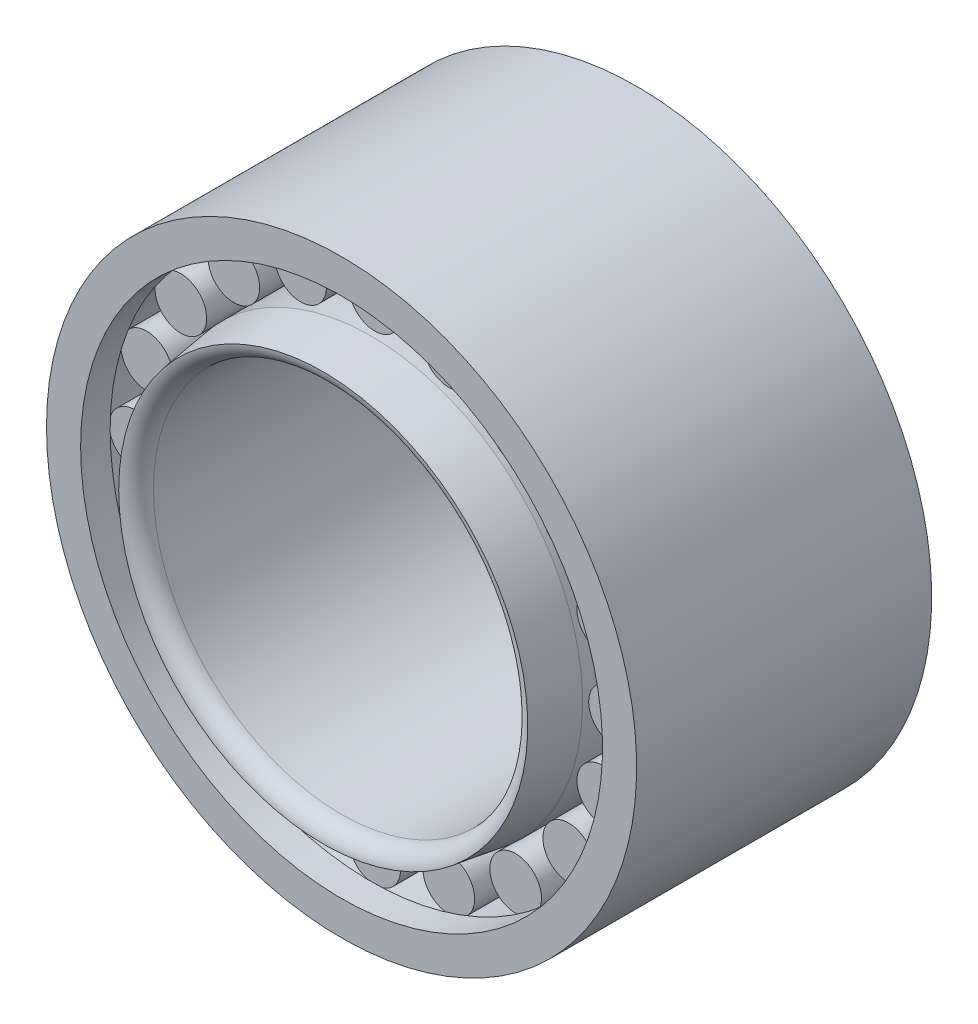
from build123d import *

# Parameters (mm, degrees)
SKETCH3_W         = 12.4
SKETCH3_H         = 1.4
CIRPATTERN1_COUNT = 20


with BuildPart() as part:
    # Sketch1 → Revolve1 (revolve)
    with BuildSketch(Plane(origin=(0, 0, 0), x_dir=(0, 0, -1), z_dir=(1, 0, 0))):
        Polygon((-8, 14.15), (-8, 16), (8, 16), (8, 14.15), (6.4, 14.15), (6.4, 14.53), (-6.4, 14.53), (-6.4, 14.15), align=None)
    revolve(axis=Axis((0, 0, -22), (0, 0, 1)))


with BuildPart() as body_2:
    # Sketch2 → Revolve2 (revolve)
    with BuildSketch(Plane(origin=(0, 0, 0), x_dir=(0, 0, -1), z_dir=(1, 0, 0))):
        with BuildLine():
            Line((-8, 10.2), (8, 10.2))
            ThreePointArc((8, 10.2), (8.667410241, 10.455309749), (8.9940278, 11.09087286))
            Line((8.9940278, 11.09087286), (6.4, 11.47))
            Line((6.4, 11.47), (-6.4, 11.47))
            Line((-6.4, 11.47), (-8.9940278, 11.09087286))
            ThreePointArc((-8.9940278, 11.09087286), (-8.667410241, 10.455309749), (-8, 10.2))
        make_face()
    revolve(axis=Axis((0, 0, -22), (0, 0, 1)))


with BuildPart() as body_3:
    # Sketch3 → Revolve3 (revolve)
    with BuildSketch(Plane(origin=(0, 0, 0), x_dir=(0, 0, -1), z_dir=(1, 0, 0))):
        with Locations((0, 13.7)):
            Rectangle(SKETCH3_W, SKETCH3_H)
    revolve(axis=Axis((0, 13, -6.2), (0, 0, 1)))


with BuildPart() as cirpattern1_1:
    # CirPattern1: pattern copy
    add(body_3.part.rotate(Axis((0, 0, -22), (0, 0, -1)), 1 * 360 / CIRPATTERN1_COUNT))


with BuildPart() as cirpattern1_2:
    # CirPattern1: pattern copy
    add(body_3.part.rotate(Axis((0, 0, -22), (0, 0, -1)), 2 * 360 / CIRPATTERN1_COUNT))


with BuildPart() as cirpattern1_3:
    # CirPattern1: pattern copy
    add(body_3.part.rotate(Axis((0, 0, -22), (0, 0, -1)), 3 * 360 / CIRPATTERN1_COUNT))


with BuildPart() as cirpattern1_4:
    # CirPattern1: pattern copy
    add(body_3.part.rotate(Axis((0, 0, -22), (0, 0, -1)), 4 * 360 / CIRPATTERN1_COUNT))


with BuildPart() as cirpattern1_5:
    # CirPattern1: pattern copy
    add(body_3.part.rotate(Axis((0, 0, -22), (0, 0, -1)), 5 * 360 / CIRPATTERN1_COUNT))


with BuildPart() as cirpattern1_6:
    # CirPattern1: pattern copy
    add(body_3.part.rotate(Axis((0, 0, -22), (0, 0, -1)), 6 * 360 / CIRPATTERN1_COUNT))


with BuildPart() as cirpattern1_7:
    # CirPattern1: pattern copy
    add(body_3.part.rotate(Axis((0, 0, -22), (0, 0, -1)), 7 * 360 / CIRPATTERN1_COUNT))


with BuildPart() as cirpattern1_8:
    # CirPattern1: pattern copy
    add(body_3.part.rotate(Axis((0, 0, -22), (0, 0, -1)), 8 * 360 / CIRPATTERN1_COUNT))


with BuildPart() as cirpattern1_9:
    # CirPattern1: pattern copy
    add(body_3.part.rotate(Axis((0, 0, -22), (0, 0, -1)), 9 * 360 / CIRPATTERN1_COUNT))


with BuildPart() as cirpattern1_10:
    # CirPattern1: pattern copy
    add(body_3.part.rotate(Axis((0, 0, -22), (0, 0, -1)), 10 * 360 / CIRPATTERN1_COUNT))


with BuildPart() as cirpattern1_11:
    # CirPattern1: pattern copy
    add(body_3.part.rotate(Axis((0, 0, -22), (0, 0, -1)), 11 * 360 / CIRPATTERN1_COUNT))


with BuildPart() as cirpattern1_12:
    # CirPattern1: pattern copy
    add(body_3.part.rotate(Axis((0, 0, -22), (0, 0, -1)), 12 * 360 / CIRPATTERN1_COUNT))


with BuildPart() as cirpattern1_13:
    # CirPattern1: pattern copy
    add(body_3.part.rotate(Axis((0, 0, -22), (0, 0, -1)), 13 * 360 / CIRPATTERN1_COUNT))


with BuildPart() as cirpattern1_14:
    # CirPattern1: pattern copy
    add(body_3.part.rotate(Axis((0, 0, -22), (0, 0, -1)), 14 * 360 / CIRPATTERN1_COUNT))


with BuildPart() as cirpattern1_15:
    # CirPattern1: pattern copy
    add(body_3.part.rotate(Axis((0, 0, -22), (0, 0, -1)), 15 * 360 / CIRPATTERN1_COUNT))


with BuildPart() as cirpattern1_16:
    # CirPattern1: pattern copy
    add(body_3.part.rotate(Axis((0, 0, -22), (0, 0, -1)), 16 * 360 / CIRPATTERN1_COUNT))


with BuildPart() as cirpattern1_17:
    # CirPattern1: pattern copy
    add(body_3.part.rotate(Axis((0, 0, -22), (0, 0, -1)), 17 * 360 / CIRPATTERN1_COUNT))


with BuildPart() as cirpattern1_18:
    # CirPattern1: pattern copy
    add(body_3.part.rotate(Axis((0, 0, -22), (0, 0, -1)), 18 * 360 / CIRPATTERN1_COUNT))


with BuildPart() as cirpattern1_19:
    # CirPattern1: pattern copy
    add(body_3.part.rotate(Axis((0, 0, -22), (0, 0, -1)), 19 * 360 / CIRPATTERN1_COUNT))


solid = Compound([part.part, body_2.part, body_3.part, cirpattern1_1.part, cirpattern1_2.part, cirpattern1_3.part, cirpattern1_4.part, cirpattern1_5.part, cirpattern1_6.part, cirpattern1_7.part, cirpattern1_8.part, cirpattern1_9.part, cirpattern1_10.part, cirpattern1_11.part, cirpattern1_12.part, cirpattern1_13.part, cirpattern1_14.part, cirpattern1_15.part, cirpattern1_16.part, cirpattern1_17.part, cirpattern1_18.part, cirpattern1_19.part])
